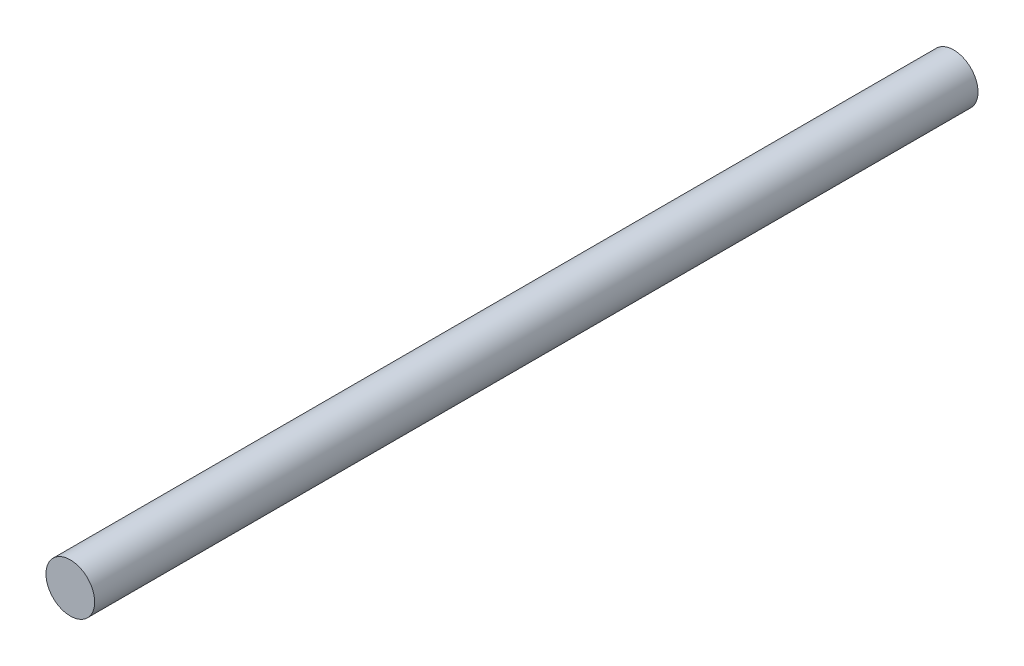
from build123d import *

# Parameters (mm, degrees)
SKETCH1_R           = 20
BOSS_EXTRUDE1_DEPTH = 725


with BuildPart() as part:
    # Sketch1 → Boss-Extrude1 (new body)
    with BuildSketch(Plane.XY):
        Circle(SKETCH1_R)
    extrude(amount=BOSS_EXTRUDE1_DEPTH)


solid = part.part
